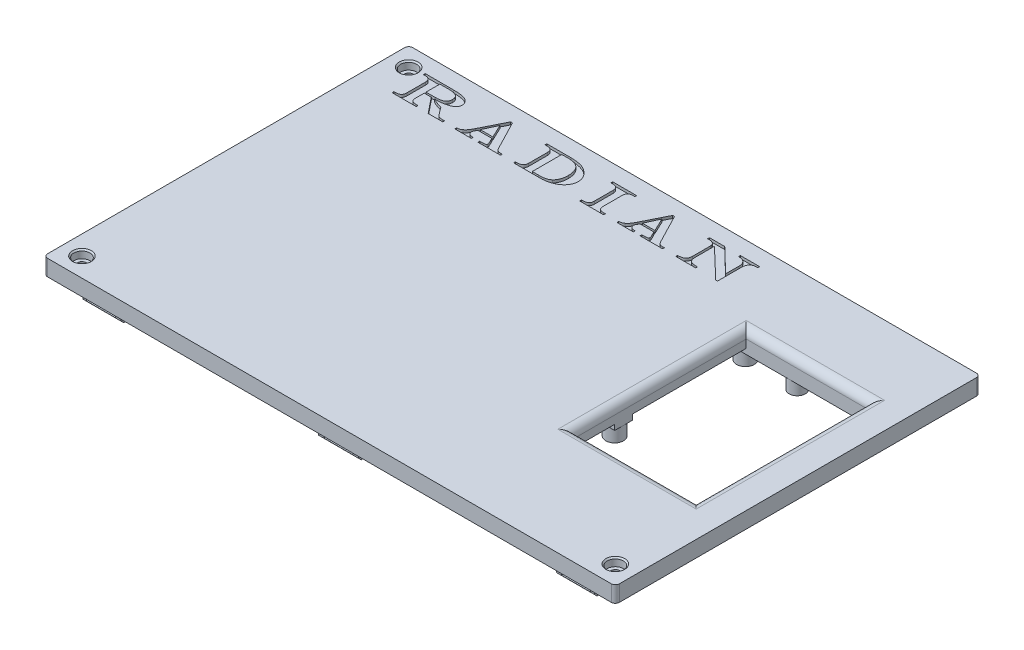
from build123d import *

# Parameters (mm, degrees)
SKETCH2_W                = 213
SKETCH2_H                = 136
BOSS_EXTRUDE1_DEPTH      = 6
SKETCH3_W                = 206.2
SKETCH3_H                = 129.2
SKETCH3_W_2              = 200.2
SKETCH3_H_2              = 123.2
BOSS_EXTRUDE2_DEPTH      = 5
CAVITY2_START            = -5
CAVITY2_DEPTH            = 4.9746
CAVITY2_START_2          = -43.000000397
CAVITY2_2_DEPTH          = 10
CAVITY2_START_3          = 133.999999603
CAVITY2_3_DEPTH          = 10
CAVITY2_START_4          = 45.501885188
CAVITY2_4_DEPTH          = 9.998720912
CAVITY2_START_5          = -52.600000397
CAVITY2_5_DEPTH          = 7.8
CAVITY2_START_6          = 145.799999603
CAVITY2_6_DEPTH          = 7.8
CAVITY2_START_7          = 45.5006061
CAVITY2_7_DEPTH          = 0.001279088
CAVITY2_START_8          = 55.5006061
CAVITY2_8_DEPTH          = 0.001279088
FILLET1_R                = 1.5
CUT_EXTRUDE11_DEPTH      = 10.4
CUT_EXTRUDE11_DEPTH_BACK = 0.4
CUT_EXTRUDE12_DEPTH      = 10.4
CUT_EXTRUDE12_DEPTH_BACK = 0.4
CUT_EXTRUDE13_DEPTH      = 10.4
CUT_EXTRUDE13_DEPTH_BACK = 0.4
CUT_EXTRUDE14_DEPTH      = 10.4
CUT_EXTRUDE14_DEPTH_BACK = 0.4
CUT_EXTRUDE16_DEPTH      = 10.4
CUT_EXTRUDE16_DEPTH_BACK = 0.4
CUT_EXTRUDE17_DEPTH      = 10.4
CUT_EXTRUDE17_DEPTH_BACK = 0.4
SKETCH21_W               = 30.188219543
SKETCH21_H               = 17.978761861
SKETCH21_W_2             = 73.700606497
SKETCH21_H_2             = 37.883194367
SKETCH21_W_3             = 73.699393503
SKETCH21_H_3             = 44.583623302
SKETCH21_W_4             = 30.925056626
SKETCH21_H_4             = 41.233408835
CUT_EXTRUDE18_DEPTH      = 206.591244647
CHAMFER4_SIZE            = 1
SKETCH22_R               = 3.3
SKETCH22_R_2             = 3
BOSS_EXTRUDE4_DEPTH      = 7
SKETCH23_W               = 6
SKETCH23_H               = 123.2
BOSS_EXTRUDE5_DEPTH      = 2
CUT_EXTRUDE19_DEPTH      = 186.002867946
CUT_EXTRUDE19_DEPTH_BACK = 186.002867946
SKETCH24_W               = 45.53325447
SKETCH24_H               = 64.188285164
FILLET6_R                = 3
SKETCH26_R               = 1.65
CUT_EXTRUDE20_DEPTH      = 4
CUT_EXTRUDE21_START      = -1
CUT_EXTRUDE21_DEPTH      = 1
SKETCH29_R               = 1.7
CUT_EXTRUDE22_DEPTH      = 186.326903603
SKETCH30_R               = 3
CUT_EXTRUDE23_DEPTH      = 3
CHAMFER5_SIZE            = 0.5


# Read off the part's stored shape, not the designer's step: Cavity2, Cut-Extrude21
with BuildPart() as part:
    # Sketch2 → Boss-Extrude1 (new body)
    with BuildSketch(Plane(origin=(0, 0, 0), x_dir=(1, 0, 0), z_dir=(0, 1, 0))):
        with Locations((50.499999603, -29.611788596)):
            Rectangle(SKETCH2_W, SKETCH2_H)
    extrude(amount=BOSS_EXTRUDE1_DEPTH)

    # Sketch3 → Boss-Extrude2 (add)
    with BuildSketch(Plane.XZ):
        with Locations((50.499999603, 29.611788596)):
            Rectangle(SKETCH3_W, SKETCH3_H)
        with Locations((50.499999603, 29.611788596)):
            Rectangle(SKETCH3_W_2, SKETCH3_H_2, mode=Mode.SUBTRACT)
    extrude(amount=BOSS_EXTRUDE2_DEPTH)

    # Cavity2 outline → Cavity2 (cut)
    with BuildSketch(Plane(origin=(0, 0, 0), x_dir=(1, 0, 0), z_dir=(0, 1, 0)).offset(CAVITY2_START)):
        with BuildLine():
            Line((-44.800000397, 31.988211404), (-44.800000397, 34.988211404))
            Line((-44.800000397, 34.988211404), (-52.600000397, 34.988211404))
            Line((-52.600000397, 34.988211404), (-52.600000397, 27.188211404))
            Line((-52.600000397, 27.188211404), (-49.600000397, 27.188211404))
            Line((-49.600000397, 27.188211404), (-49.600000397, 29.355181126))
            ThreePointArc((-49.600000397, 29.355181126), (-50.214213959, 32.602424966), (-46.966970119, 31.988211404))
            Line((-46.966970119, 31.988211404), (-44.800000397, 31.988211404))
        make_face()
        with BuildLine():
            Line((153.599999603, -86.411788596), (150.599999603, -86.411788596))
            Line((150.599999603, -86.411788596), (150.599999603, -88.578758318))
            ThreePointArc((150.599999603, -88.578758318), (151.214213165, -91.826002158), (147.966969325, -91.211788596))
            Line((147.966969325, -91.211788596), (145.799999603, -91.211788596))
            Line((145.799999603, -91.211788596), (145.799999603, -94.211788596))
            Line((145.799999603, -94.211788596), (153.599999603, -94.211788596))
            Line((153.599999603, -94.211788596), (153.599999603, -86.411788596))
        make_face()
        with BuildLine():
            Line((-49.600000397, -86.411788596), (-52.600000397, -86.411788596))
            Line((-52.600000397, -86.411788596), (-52.600000397, -94.211788596))
            Line((-52.600000397, -94.211788596), (-44.800000397, -94.211788596))
            Line((-44.800000397, -94.211788596), (-44.800000397, -91.211788596))
            Line((-44.800000397, -91.211788596), (-46.966970119, -91.211788596))
            ThreePointArc((-46.966970119, -91.211788596), (-50.214213959, -91.826002158), (-49.600000397, -88.578758318))
            Line((-49.600000397, -88.578758318), (-49.600000397, -86.411788596))
        make_face()
    extrude(amount=CAVITY2_DEPTH, mode=Mode.SUBTRACT)

    # Cavity2 2 outline → Cavity2 2 (cut)
    with BuildSketch(Plane.YZ.offset(CAVITY2_START_2)):
        with BuildLine():
            ThreePointArc((-2.742557288, -34.671054117), (-3.0254, -34.553896829), (-3.308242712, -34.671054117))
            Line((-3.308242712, -34.671054117), (-3.6254, -34.988211404))
            Line((-3.6254, -34.988211404), (-2.4254, -34.988211404))
            Line((-2.4254, -34.988211404), (-2.742557288, -34.671054117))
        make_face()
        with BuildLine():
            Line((-3.6254, 94.211788596), (-3.308242712, 93.894631308))
            ThreePointArc((-3.308242712, 93.894631308), (-3.0254, 93.777474021), (-2.742557288, 93.894631308))
            Line((-2.742557288, 93.894631308), (-2.4254, 94.211788596))
            Line((-2.4254, 94.211788596), (-3.6254, 94.211788596))
        make_face()
    extrude(amount=CAVITY2_2_DEPTH, mode=Mode.SUBTRACT)

    # Cavity2 3 outline → Cavity2 3 (cut)
    with BuildSketch(Plane.YZ.offset(CAVITY2_START_3)):
        with BuildLine():
            ThreePointArc((-2.742557288, -34.671054117), (-3.0254, -34.553896829), (-3.308242712, -34.671054117))
            Line((-3.308242712, -34.671054117), (-3.6254, -34.988211404))
            Line((-3.6254, -34.988211404), (-2.4254, -34.988211404))
            Line((-2.4254, -34.988211404), (-2.742557288, -34.671054117))
        make_face()
        with BuildLine():
            Line((-3.6254, 94.211788596), (-3.308242712, 93.894631308))
            ThreePointArc((-3.308242712, 93.894631308), (-3.0254, 93.777474021), (-2.742557288, 93.894631308))
            Line((-2.742557288, 93.894631308), (-2.4254, 94.211788596))
            Line((-2.4254, 94.211788596), (-3.6254, 94.211788596))
        make_face()
    extrude(amount=CAVITY2_3_DEPTH, mode=Mode.SUBTRACT)

    # Cavity2 4 outline → Cavity2 4 (cut)
    with BuildSketch(Plane.YZ.offset(CAVITY2_START_4)):
        with BuildLine():
            ThreePointArc((-2.742557288, -34.671054117), (-3.0254, -34.553896829), (-3.308242712, -34.671054117))
            Line((-3.308242712, -34.671054117), (-3.6254, -34.988211404))
            Line((-3.6254, -34.988211404), (-2.4254, -34.988211404))
            Line((-2.4254, -34.988211404), (-2.742557288, -34.671054117))
        make_face()
        with BuildLine():
            Line((-3.6254, 94.211788596), (-3.308242712, 93.894631308))
            ThreePointArc((-3.308242712, 93.894631308), (-3.0254, 93.777474021), (-2.742557288, 93.894631308))
            Line((-2.742557288, 93.894631308), (-2.4254, 94.211788596))
            Line((-2.4254, 94.211788596), (-3.6254, 94.211788596))
        make_face()
    extrude(amount=CAVITY2_4_DEPTH, mode=Mode.SUBTRACT)

    # Cavity2 5 outline → Cavity2 5 (cut)
    with BuildSketch(Plane.YZ.offset(CAVITY2_START_5)):
        with BuildLine():
            ThreePointArc((-2.742557288, -34.671054117), (-3.0254, -34.553896829), (-3.308242712, -34.671054117))
            Line((-3.308242712, -34.671054117), (-3.6254, -34.988211404))
            Line((-3.6254, -34.988211404), (-2.4254, -34.988211404))
            Line((-2.4254, -34.988211404), (-2.742557288, -34.671054117))
        make_face()
        with BuildLine():
            Line((-3.6254, 94.211788596), (-3.308242712, 93.894631308))
            ThreePointArc((-3.308242712, 93.894631308), (-3.0254, 93.777474021), (-2.742557288, 93.894631308))
            Line((-2.742557288, 93.894631308), (-2.4254, 94.211788596))
            Line((-2.4254, 94.211788596), (-3.6254, 94.211788596))
        make_face()
    extrude(amount=CAVITY2_5_DEPTH, mode=Mode.SUBTRACT)

    # Cavity2 6 outline → Cavity2 6 (cut)
    with BuildSketch(Plane.YZ.offset(CAVITY2_START_6)):
        with BuildLine():
            Line((-3.6254, 94.211788596), (-3.308242712, 93.894631308))
            ThreePointArc((-3.308242712, 93.894631308), (-3.0254, 93.777474021), (-2.742557288, 93.894631308))
            Line((-2.742557288, 93.894631308), (-2.4254, 94.211788596))
            Line((-2.4254, 94.211788596), (-3.6254, 94.211788596))
        make_face()
    extrude(amount=CAVITY2_6_DEPTH, mode=Mode.SUBTRACT)

    # Cavity2 7 outline → Cavity2 7 (cut)
    with BuildSketch(Plane.YZ.offset(CAVITY2_START_7)):
        with BuildLine():
            Line((-3.6254, 94.211788596), (-3.308242712, 93.894631308))
            ThreePointArc((-3.308242712, 93.894631308), (-3.0254, 93.777474021), (-2.742557288, 93.894631308))
            Line((-2.742557288, 93.894631308), (-2.4254, 94.211788596))
            Line((-2.4254, 94.211788596), (-3.6254, 94.211788596))
        make_face()
    extrude(amount=CAVITY2_7_DEPTH, mode=Mode.SUBTRACT)

    # Cavity2 8 outline → Cavity2 8 (cut)
    with BuildSketch(Plane.YZ.offset(CAVITY2_START_8)):
        with BuildLine():
            ThreePointArc((-2.742557288, -34.671054117), (-3.0254, -34.553896829), (-3.308242712, -34.671054117))
            Line((-3.308242712, -34.671054117), (-3.6254, -34.988211404))
            Line((-3.6254, -34.988211404), (-2.4254, -34.988211404))
            Line((-2.4254, -34.988211404), (-2.742557288, -34.671054117))
        make_face()
    extrude(amount=CAVITY2_8_DEPTH, mode=Mode.SUBTRACT)

    # Fillet1
    fillet1_edges = [part.edges().sort_by_distance(p)[0] for p in [
        (156.999999603, 3, 97.611788596),
        (-56.000000397, 3, 97.611788596),
        (-56.000000397, 3, -38.388211404),
        (156.999999603, 3, -38.388211404),
    ]]
    fillet(fillet1_edges, radius=FILLET1_R)

    # Sketch14 → Cut-Extrude11 (cut, two sides: drawn at the far end of the back side and taken through both)
    with BuildSketch(Plane(origin=(-43.000000397, 0, 0), x_dir=(0, 0, -1), z_dir=(1, 0, 0)).offset(-CUT_EXTRUDE11_DEPTH_BACK)):
        Polygon((-94.353528476, -1.717974695), (-93.187524527, -2.883978644), (-94.416466858, -4.112920975), align=None)
    extrude(amount=CUT_EXTRUDE11_DEPTH + CUT_EXTRUDE11_DEPTH_BACK, mode=Mode.SUBTRACT)

    # Sketch15 → Cut-Extrude12 (cut, two sides: drawn at the far end of the back side and taken through both)
    with BuildSketch(Plane.ZY.offset(-55.5006061).offset(-CUT_EXTRUDE12_DEPTH_BACK)):
        Polygon((94.853600808, -1.217902363), (93.187524527, -2.883978644), (95.132348202, -4.828802319), align=None)
    extrude(amount=CUT_EXTRUDE12_DEPTH + CUT_EXTRUDE12_DEPTH_BACK, mode=Mode.SUBTRACT)

    # Sketch16 → Cut-Extrude13 (cut, two sides: drawn at the far end of the back side and taken through both)
    with BuildSketch(Plane.ZY.offset(-143.999999603).offset(-CUT_EXTRUDE13_DEPTH_BACK)):
        Polygon((94.69839733, -1.373105841), (93.187524527, -2.883978644), (95.464915153, -5.161369269), align=None)
    extrude(amount=CUT_EXTRUDE13_DEPTH + CUT_EXTRUDE13_DEPTH_BACK, mode=Mode.SUBTRACT)

    # Sketch17 → Cut-Extrude14 (cut, two sides: drawn at the far end of the back side and taken through both)
    with BuildSketch(Plane(origin=(-43.000000397, 0, 0), x_dir=(0, 0, -1), z_dir=(1, 0, 0)).offset(-CUT_EXTRUDE14_DEPTH_BACK)):
        Polygon((35.355341415, -1.492584564), (33.963947335, -2.883978644), (35.071405453, -3.991436761), align=None)
    extrude(amount=CUT_EXTRUDE14_DEPTH + CUT_EXTRUDE14_DEPTH_BACK, mode=Mode.SUBTRACT)

    # Sketch18 → Cut-Extrude16 (cut, two sides: drawn at the far end of the back side and taken through both)
    with BuildSketch(Plane(origin=(45.501885188, 0, 0), x_dir=(0, 0, -1), z_dir=(1, 0, 0)).offset(-CUT_EXTRUDE16_DEPTH_BACK)):
        Polygon((35.566076624, -1.281849355), (33.963947335, -2.883978644), (35.899977656, -4.820008964), align=None)
    extrude(amount=CUT_EXTRUDE16_DEPTH + CUT_EXTRUDE16_DEPTH_BACK, mode=Mode.SUBTRACT)

    # Sketch19 → Cut-Extrude17 (cut, two sides: drawn at the far end of the back side and taken through both)
    with BuildSketch(Plane(origin=(133.999999603, 0, 0), x_dir=(0, 0, -1), z_dir=(1, 0, 0)).offset(-CUT_EXTRUDE17_DEPTH_BACK)):
        Polygon((35.809407674, -1.038518305), (33.963947335, -2.883978644), (35.992757415, -4.912788724), align=None)
    extrude(amount=CUT_EXTRUDE17_DEPTH + CUT_EXTRUDE17_DEPTH_BACK, mode=Mode.SUBTRACT)

    # Sketch21 → Cut-Extrude18 (cut, through all)
    with BuildSketch(Plane.XY.offset(94.211788596)):
        with Locations((-60.494110169, -10.849095506)):
            Rectangle(SKETCH21_W, SKETCH21_H)
        with Locations((6.250302851, -20.801311758)):
            Rectangle(SKETCH21_W_2, SKETCH21_H_2)
        with Locations((94.750302852, -24.151526226)):
            Rectangle(SKETCH21_W_3, SKETCH21_H_3)
        with Locations((161.862527916, -22.476418993)):
            Rectangle(SKETCH21_W_4, SKETCH21_H_4)
    extrude(amount=-CUT_EXTRUDE18_DEPTH, mode=Mode.SUBTRACT)

    # Chamfer4
    chamfer4_edges = [part.edges().sort_by_distance(p)[0] for p in [
        (-37.700000397, -5, -34.988211404),
        (50.5006061, -5, 94.211788596),
        (-37.700000397, -5, 94.211788596),
        (50.5006061, -5, -34.988211404),
        (138.999999603, -5, -34.988211404),
        (138.699999603, -5, 94.211788596),
    ]]
    chamfer(chamfer4_edges, length=CHAMFER4_SIZE)

    # Sketch22 → Boss-Extrude4 (add)
    with BuildSketch(Plane.XZ):
        with Locations(Location((46.940785486, 86.211788596, 0), (0, 0, 270))):
            Circle(SKETCH22_R)
        with Locations(Location((-2.059214514, 86.211788596, 0), (0, 0, 270))):
            Circle(SKETCH22_R)
        with Locations(Location((46.940785486, 28.211788596, 0), (0, 0, 270))):
            Circle(SKETCH22_R)
        with Locations(Location((-2.059214514, 28.211788596, 0), (0, 0, 270))):
            Circle(SKETCH22_R)
        with Locations(Location((64.734891786, -12.788874358, 0), (0, 0, 270))):
            Circle(SKETCH22_R)
        with Locations(Location((64.734891786, 36.211125642, 0), (0, 0, 270))):
            Circle(SKETCH22_R)
        with Locations(Location((86.27684887, -12.788874358, 0), (0, 0, 270))):
            Circle(SKETCH22_R)
        with Locations(Location((86.27684887, 36.114733843, 0), (0, 0, 270))):
            Circle(SKETCH22_R)
        with Locations(Location((95.087234702, -12.788874358, 0), (0, 0, 270))):
            Circle(SKETCH22_R)
        with Locations(Location((95.37114887, 36.211125642, 0), (0, 0, 270))):
            Circle(SKETCH22_R)
        with Locations(Location((114.37114887, -12.788874358, 0), (0, 0, 270))):
            Circle(SKETCH22_R_2)
    extrude(amount=BOSS_EXTRUDE4_DEPTH)

    # Sketch23 → Boss-Extrude5 (add)
    with BuildSketch(Plane.XZ):
        with Locations((-2.059214514, 29.611788596)):
            Rectangle(SKETCH23_W, SKETCH23_H)
        Polygon((43.640785486, 58.265710988), (43.640785486, -33.609956021), (50.240785486, -33.609956021), (50.240785486, -16.088874358), (150.468692023, -16.088874358), (150.468692023, -9.488874358), (50.240785486, -9.488874358), (50.240785486, 32.911125642), (150.599999603, 32.911125642), (150.599999603, 39.511125642), (50.240785486, 39.511125642), (50.240785486, 91.211788596), (43.640785486, 91.211788596), align=None)
    extrude(amount=BOSS_EXTRUDE5_DEPTH)

    # Sketch24 → Cut-Extrude19 (cut, two sides: drawn at the far end of the back side and taken through both)
    with BuildSketch(Plane.XZ.offset(-CUT_EXTRUDE19_DEPTH_BACK)):
        with Locations((121.437776105, 22.605268224)):
            Rectangle(SKETCH24_W, SKETCH24_H)
    extrude(amount=CUT_EXTRUDE19_DEPTH + CUT_EXTRUDE19_DEPTH_BACK, mode=Mode.SUBTRACT)

    # Fillet6
    fillet6_edges = [part.edges().sort_by_distance(p)[0] for p in [
        (121.437776105, 6, -9.488874358),
        (98.67114887, 6, 22.605268224),
        (121.437776105, 6, 54.699410806),
        (144.20440334, 6, 22.605268224),
    ]]
    fillet(fillet6_edges, radius=FILLET6_R)

    # Sketch26 → Cut-Extrude20 (cut)
    with BuildSketch(Plane.XZ.offset(7)):
        with Locations(Location((46.940785486, 28.211788596, 0), (0, 0, 270))):
            Circle(SKETCH26_R)
        with Locations(Location((-2.059214514, 28.211788596, 0), (0, 0, 270))):
            Circle(SKETCH26_R)
        with Locations(Location((-2.059214514, 86.211788596, 0), (0, 0, 270))):
            Circle(SKETCH26_R)
        with Locations(Location((46.940785486, 86.211788596, 0), (0, 0, 270))):
            Circle(SKETCH26_R)
        with Locations(Location((64.734891786, -12.788874358, 0), (0, 0, 270))):
            Circle(SKETCH26_R)
        with Locations(Location((86.27684887, -12.788874358, 0), (0, 0, 270))):
            Circle(SKETCH26_R)
        with Locations(Location((95.087234702, -12.788874358, 0), (0, 0, 270))):
            Circle(SKETCH26_R)
        with Locations(Location((114.37114887, -12.788874358, 0), (0, 0, 270))):
            Circle(SKETCH26_R)
        with Locations(Location((95.37114887, 36.211125642, 0), (0, 0, 270))):
            Circle(SKETCH26_R)
        with Locations(Location((86.27684887, 36.114733843, 0), (0, 0, 270))):
            Circle(SKETCH26_R)
        with Locations(Location((64.734891786, 36.211125642, 0), (0, 0, 270))):
            Circle(SKETCH26_R)
    extrude(amount=-CUT_EXTRUDE20_DEPTH, mode=Mode.SUBTRACT)

    # Cut-Extrude21 outline → Cut-Extrude21 (cut)
    # profile 1 of 6: a face of its own
    with BuildSketch(Plane(origin=(0, 6, 0), x_dir=(1, 0, 0), z_dir=(0, 1, 0)).offset(CUT_EXTRUDE21_START)):
        with BuildLine():
            add(Edge.make_bspline(
                [(76.787164818, 28.69194135), (76.783293868, 28.837057), (76.775745705, 29.120025461), (76.713495937, 29.5302152), (76.606232006, 29.911250759), (76.458186723, 30.261617616), (76.270483801, 30.578256258), (76.046060029, 30.858164756), (75.779632483, 31.093348759), (75.578759636, 31.215418903), (75.477842893, 31.276745864)],
                knots=[0, 0, 0, 0, 0.142880424, 0.278609878, 0.407384071, 0.531829129, 0.65215669, 0.768807633, 0.883850999, 1, 1, 1, 1], degree=3))
            Line((76.787164818, 28.69194135), (76.787164818, 23.683719915))
            Line((76.787164818, 23.683719915), (67.798917096, 32.346589425))
            Line((67.798917096, 32.346589425), (62.126924108, 32.346589425))
            Line((62.126924108, 32.346589425), (62.126924108, 31.680214847))
            Line((62.126924108, 31.680214847), (62.465317448, 31.680214847))
            add(Edge.make_bspline(
                [(64.959016063, 29.873715015), (64.955480626, 29.965059217), (64.948617802, 30.142372264), (64.896640635, 30.39763605), (64.806412327, 30.631366128), (64.680972158, 30.843776286), (64.518783536, 31.033361474), (64.324013141, 31.202430139), (64.091382901, 31.34437765), (63.828148027, 31.467150898), (63.530788088, 31.562911851), (63.202893718, 31.632035397), (62.843847031, 31.674104469), (62.594720795, 31.678125966), (62.465317448, 31.680214847)],
                knots=[0, 0, 0, 0, 0.078830819, 0.15302266, 0.223693261, 0.294224766, 0.364915215, 0.438205283, 0.515942944, 0.599393584, 0.68846488, 0.784995083, 0.888320249, 1, 1, 1, 1], degree=3))
            Line((64.959016063, 29.873715015), (64.959016063, 23.100642159))
            add(Edge.make_bspline(
                [(61.887445744, 20.659004058), (61.984674439, 20.66439797), (62.174151731, 20.674909515), (62.448361193, 20.701408781), (62.70525797, 20.732791056), (62.944332567, 20.768139405), (63.166013417, 20.811901666), (63.369735005, 20.864806799), (63.556109461, 20.920697369), (63.777176666, 21.002759633), (64.022917984, 21.128042425), (64.281946915, 21.310306415), (64.497626207, 21.52761905), (64.668076093, 21.779188068), (64.79997679, 22.063256819), (64.891471547, 22.380192502), (64.950541763, 22.729692205), (64.956116168, 22.973703535), (64.959016063, 23.100642159)],
                knots=[0, 0, 0, 0, 0.065040812, 0.126750204, 0.183974322, 0.237910516, 0.288151362, 0.334821905, 0.378457035, 0.41807323, 0.492206473, 0.562008052, 0.628812, 0.695527891, 0.763980954, 0.837149536, 0.915282565, 1, 1, 1, 1], degree=3))
            Line((61.887445744, 20.659004058), (61.887445744, 20.018659737))
            Line((61.887445744, 20.018659737), (69.329496204, 20.018659737))
            Line((69.329496204, 20.018659737), (69.329496204, 20.656401032))
            add(Edge.make_bspline(
                [(67.910847201, 20.752712983), (67.991479296, 20.742569841), (68.177506882, 20.719168439), (68.494588746, 20.695701028), (68.886731988, 20.671337568), (69.173274345, 20.661671136), (69.329496204, 20.656401032)],
                knots=[0, 0, 0, 0, 0.171371595, 0.395374126, 0.670360155, 1, 1, 1, 1], degree=3))
            add(Edge.make_bspline(
                [(66.775927998, 21.083297246), (66.861950685, 21.041631046), (67.035714821, 20.957466143), (67.313357082, 20.862270686), (67.606089554, 20.790444825), (67.808109494, 20.76543287), (67.910847201, 20.752712983)],
                knots=[0, 0, 0, 0, 0.240979803, 0.48677446, 0.738997967, 1, 1, 1, 1], degree=3))
            add(Edge.make_bspline(
                [(65.791984286, 23.569186784), (65.794321459, 23.405045149), (65.79873603, 23.095006152), (65.848533264, 22.657700265), (65.926280532, 22.275705117), (66.037402069, 21.946453235), (66.18361171, 21.668255551), (66.35286173, 21.431932557), (66.548123614, 21.231992116), (66.700140961, 21.132765756), (66.775927998, 21.083297246)],
                knots=[0, 0, 0, 0, 0.175752568, 0.331970315, 0.470693642, 0.592677048, 0.702846023, 0.806030556, 0.90329808, 1, 1, 1, 1], degree=3))
            Line((65.791984286, 23.569186784), (65.791984286, 30.516662362))
            Line((65.791984286, 30.516662362), (76.935537282, 19.852066093))
            Line((76.935537282, 19.852066093), (77.62013304, 19.852066093))
            Line((77.62013304, 19.852066093), (77.62013304, 28.619056631))
            add(Edge.make_bspline(
                [(80.314264633, 31.680214847), (80.209996422, 31.678885976), (80.006846539, 31.676296883), (79.711290862, 31.636717447), (79.432083736, 31.583090755), (79.173325525, 31.497239173), (78.930673204, 31.394718043), (78.709596071, 31.262519073), (78.503407705, 31.111300599), (78.318455589, 30.933248972), (78.153493063, 30.731282502), (78.008763984, 30.504541217), (77.886344866, 30.252397579), (77.791959382, 29.972524077), (77.712685166, 29.671083044), (77.659824915, 29.342450442), (77.624896606, 28.989448716), (77.621752283, 28.744961194), (77.62013304, 28.619056631)],
                knots=[0, 0, 0, 0, 0.067018953, 0.130575679, 0.191550435, 0.249625434, 0.305621893, 0.36066717, 0.414922848, 0.469798056, 0.52533078, 0.582311765, 0.642476352, 0.705144474, 0.772023814, 0.842774252, 0.919032927, 1, 1, 1, 1], degree=3))
            Line((80.314264633, 31.680214847), (80.785412284, 31.680214847))
            Line((80.785412284, 31.680214847), (80.785412284, 32.346589425))
            Line((80.785412284, 32.346589425), (73.621885574, 32.346589425))
            Line((73.621885574, 32.346589425), (73.621885574, 31.69062695))
            add(Edge.make_bspline(
                [(75.477842893, 31.276745864), (75.363150069, 31.335883325), (75.139260979, 31.451324133), (74.8302572, 31.54612584), (74.554648068, 31.596281262), (74.293145834, 31.631813007), (73.976380716, 31.665678946), (73.746032452, 31.68188997), (73.621885574, 31.69062695)],
                knots=[0, 0, 0, 0, 0.20138717, 0.393123027, 0.502173024, 0.639110626, 0.805497606, 1, 1, 1, 1], degree=3))
        make_face()
    # profile 2 of 6: a face of its own
    with BuildSketch(Plane(origin=(0, 6, 0), x_dir=(1, 0, 0), z_dir=(0, 1, 0)).offset(CUT_EXTRUDE21_START)):
        with BuildLine():
            add(Edge.make_bspline(
                [(54.288693138, 22.030798599), (54.333486908, 21.945953833), (54.419089865, 21.783811579), (54.560179589, 21.562628356), (54.700851241, 21.370349039), (54.843791708, 21.207276624), (54.992410867, 21.072508696), (55.14374284, 20.959278797), (55.300350469, 20.868323465), (55.461950548, 20.795020193), (55.636925409, 20.746349334), (55.825762331, 20.709942954), (56.033162738, 20.689808869), (56.176714546, 20.686667902), (56.251374511, 20.685034315)],
                knots=[0, 0, 0, 0, 0.113190473, 0.216312206, 0.309295546, 0.394166009, 0.471728587, 0.5456642, 0.616795127, 0.685105998, 0.754452864, 0.830568863, 0.911880435, 1, 1, 1, 1], degree=3))
            Line((54.288693138, 22.030798599), (48.759866564, 32.679776713))
            Line((48.759866564, 32.679776713), (48.064858703, 32.679776713))
            Line((48.064858703, 32.679776713), (43.68396646, 23.931007355))
            add(Edge.make_bspline(
                [(41.747315344, 21.28633325), (41.830135417, 21.34903099), (42.002571083, 21.479570921), (42.246941197, 21.714722215), (42.490151356, 21.988019714), (42.733471881, 22.300268621), (42.973821903, 22.651314158), (43.214056277, 23.041538698), (43.45308364, 23.470933282), (43.605288707, 23.774228283), (43.68396646, 23.931007355)],
                knots=[0, 0, 0, 0, 0.094113707, 0.195949595, 0.306816844, 0.425630226, 0.554594339, 0.692354677, 0.840972162, 1, 1, 1, 1], degree=3))
            add(Edge.make_bspline(
                [(39.95383064, 20.666813135), (40.065826697, 20.680110501), (40.272870805, 20.704692986), (40.559252014, 20.747136232), (40.795740334, 20.79844014), (40.995494614, 20.856587921), (41.173805694, 20.936450059), (41.356405261, 21.029466179), (41.549585994, 21.148160273), (41.679251842, 21.238770576), (41.747315344, 21.28633325)],
                knots=[0, 0, 0, 0, 0.175528749, 0.324495293, 0.450309109, 0.551971045, 0.647540469, 0.753832122, 0.870782879, 1, 1, 1, 1], degree=3))
            Line((39.95383064, 20.666813135), (39.95383064, 20.018659737))
            Line((39.95383064, 20.018659737), (46.063131944, 20.018659737))
            Line((46.063131944, 20.018659737), (46.063131944, 20.666813135))
            add(Edge.make_bspline(
                [(44.803267508, 20.921909653), (44.848075794, 20.898683539), (44.931543496, 20.85541854), (45.052737877, 20.804641486), (45.155565562, 20.761016797), (45.257325975, 20.730452256), (45.383248368, 20.712282743), (45.556379435, 20.699622391), (45.78954584, 20.679179343), (45.965034845, 20.671247165), (46.063131944, 20.666813135)],
                knots=[0, 0, 0, 0, 0.116255279, 0.216557292, 0.302704918, 0.373572751, 0.460689656, 0.595202459, 0.773721067, 1, 1, 1, 1], degree=3))
            add(Edge.make_bspline(
                [(43.975505338, 22.166155935), (43.978170015, 22.100706889), (43.983506187, 21.969641372), (44.038007234, 21.777543516), (44.114118008, 21.587995511), (44.22744883, 21.411707469), (44.356660418, 21.25185502), (44.496060598, 21.113174297), (44.644346018, 21.002431557), (44.751245271, 20.948268137), (44.803267508, 20.921909653)],
                knots=[0, 0, 0, 0, 0.124733996, 0.249787076, 0.379097299, 0.5138815, 0.648257263, 0.771349951, 0.888728061, 1, 1, 1, 1], degree=3))
            add(Edge.make_bspline(
                [(44.326913806, 23.087627031), (44.27320188, 23.012775413), (44.170056363, 22.869034363), (44.060474863, 22.6355686), (43.986707318, 22.402318772), (43.979193094, 22.243902088), (43.975505338, 22.166155935)],
                knots=[0, 0, 0, 0, 0.274807347, 0.527725353, 0.76822178, 1, 1, 1, 1], degree=3))
            Line((44.326913806, 23.087627031), (44.683528327, 23.850313559))
            Line((44.683528327, 23.850313559), (49.899991818, 23.850313559))
            Line((49.899991818, 23.850313559), (50.074394539, 23.491096013))
            add(Edge.make_bspline(
                [(50.280033569, 23.079817953), (50.267715454, 23.103160634), (50.237461892, 23.160490771), (50.19175292, 23.259530499), (50.138142607, 23.374615678), (50.095645257, 23.452266746), (50.074394539, 23.491096013)],
                knots=[0, 0, 0, 0, 0.172133662, 0.422764058, 0.711354282, 1, 1, 1, 1], degree=3))
            add(Edge.make_bspline(
                [(50.998468661, 21.288936276), (50.996633298, 21.326318745), (50.992634755, 21.407760672), (50.96875166, 21.53639668), (50.924307717, 21.678974025), (50.877625299, 21.808714096), (50.828957694, 21.928632415), (50.783845074, 22.040016766), (50.720957221, 22.167162621), (50.655953488, 22.31543607), (50.575506382, 22.480061799), (50.489394858, 22.664738297), (50.385103898, 22.864678651), (50.316135504, 23.005896561), (50.280033569, 23.079817953)],
                knots=[0, 0, 0, 0, 0.057797256, 0.125917842, 0.201435925, 0.288385481, 0.338930854, 0.401435778, 0.474015981, 0.5580208, 0.651583825, 0.757137928, 0.872872338, 1, 1, 1, 1], degree=3))
            add(Edge.make_bspline(
                [(49.733398173, 20.685034315), (49.84193856, 20.686873359), (50.042104927, 20.690264859), (50.315694078, 20.717767898), (50.538216189, 20.761010971), (50.711418878, 20.828072137), (50.840402279, 20.917150538), (50.933494921, 21.023612306), (50.988124126, 21.151546774), (50.9949685, 21.242449375), (50.998468661, 21.288936276)],
                knots=[0, 0, 0, 0, 0.208408828, 0.384340234, 0.527497051, 0.642612622, 0.738312014, 0.825794972, 0.910912871, 1, 1, 1, 1], degree=3))
            Line((49.733398173, 20.685034315), (48.567242662, 20.685034315))
            Line((48.567242662, 20.685034315), (48.567242662, 20.018659737))
            Line((48.567242662, 20.018659737), (56.94117632, 20.018659737))
            Line((56.94117632, 20.018659737), (56.94117632, 20.685034315))
            Line((56.94117632, 20.685034315), (56.251374511, 20.685034315))
        make_face()
        Polygon((47.24490561, 29.514497469), (49.62667412, 24.516688137), (44.930815767, 24.516688137), align=None, mode=Mode.SUBTRACT)
    # profile 3 of 6: a face of its own
    with BuildSketch(Plane(origin=(0, 6, 0), x_dir=(1, 0, 0), z_dir=(0, 1, 0)).offset(CUT_EXTRUDE21_START)):
        with BuildLine():
            add(Edge.make_bspline(
                [(26.60239125, 20.685034315), (26.697033689, 20.686347755), (26.880551046, 20.688894594), (27.145479219, 20.713670811), (27.392372097, 20.747699252), (27.617415632, 20.803080691), (27.824907742, 20.870153329), (28.010989968, 20.956263316), (28.180005068, 21.054600907), (28.327392542, 21.170823834), (28.457162858, 21.302740801), (28.56844189, 21.452372881), (28.667063633, 21.616716161), (28.74115652, 21.801945597), (28.800681206, 22.00246289), (28.844987859, 22.219215586), (28.871329004, 22.452699978), (28.873637891, 22.613805272), (28.874832681, 22.697173176)],
                knots=[0, 0, 0, 0, 0.081133488, 0.157322692, 0.228036004, 0.294628529, 0.355804738, 0.414736152, 0.470117574, 0.523108175, 0.57519784, 0.628324087, 0.682686472, 0.739063606, 0.798857693, 0.86189693, 0.928535163, 1, 1, 1, 1], degree=3))
            Line((26.60239125, 20.685034315), (26.060961905, 20.685034315))
            Line((26.060961905, 20.685034315), (26.060961905, 20.018659737))
            Line((26.060961905, 20.018659737), (35.007561216, 20.018659737))
            Line((35.007561216, 20.018659737), (35.007561216, 20.685034315))
            Line((35.007561216, 20.685034315), (34.302141253, 20.685034315))
            add(Edge.make_bspline(
                [(32.206705569, 22.697173176), (32.208158837, 22.609493963), (32.210955921, 22.440739014), (32.233457224, 22.19763853), (32.275488071, 21.974821675), (32.332372478, 21.770767234), (32.404338025, 21.585089731), (32.494011885, 21.41937782), (32.59745479, 21.271053114), (32.722857527, 21.14565601), (32.861963535, 21.034490392), (33.019217166, 20.941177987), (33.192599027, 20.863372841), (33.381618321, 20.798080177), (33.587841071, 20.74588), (33.811727177, 20.710302773), (34.051869296, 20.68988053), (34.217069046, 20.686681636), (34.302141253, 20.685034315)],
                knots=[0, 0, 0, 0, 0.078253205, 0.150612843, 0.217596537, 0.280359846, 0.339466616, 0.394908273, 0.448204334, 0.500230512, 0.552601392, 0.606790246, 0.662936003, 0.72196154, 0.785072677, 0.852551479, 0.924069067, 1, 1, 1, 1], degree=3))
            Line((32.206705569, 22.697173176), (32.206705569, 29.668075985))
            add(Edge.make_bspline(
                [(34.302141253, 31.680214847), (34.216208404, 31.678532432), (34.049289812, 31.675264457), (33.807317253, 31.655376545), (33.583024547, 31.618576833), (33.375398021, 31.569832796), (33.184907828, 31.505375941), (33.012298433, 31.424480704), (32.857379365, 31.329657578), (32.71672701, 31.223332289), (32.59515932, 31.095643308), (32.491102885, 30.948701917), (32.402687261, 30.783245039), (32.327953772, 30.598780205), (32.276599569, 30.392440155), (32.233345905, 30.168537201), (32.211009379, 29.924488734), (32.208177115, 29.755747877), (32.206705569, 29.668075985)],
                knots=[0, 0, 0, 0, 0.076603746, 0.148797457, 0.216187169, 0.279029642, 0.33870842, 0.395104489, 0.448560079, 0.500385003, 0.55180436, 0.605030057, 0.660398516, 0.718708449, 0.781930523, 0.849586004, 0.921850109, 1, 1, 1, 1], degree=3))
            Line((34.302141253, 31.680214847), (35.007561216, 31.680214847))
            Line((35.007561216, 31.680214847), (35.007561216, 32.346589425))
            Line((35.007561216, 32.346589425), (26.060961905, 32.346589425))
            Line((26.060961905, 32.346589425), (26.060961905, 31.680214847))
            Line((26.060961905, 31.680214847), (26.60239125, 31.680214847))
            add(Edge.make_bspline(
                [(28.226679283, 31.258524684), (28.179669624, 31.292595786), (28.083889775, 31.362013967), (27.922733282, 31.447827547), (27.745409937, 31.519821225), (27.550818516, 31.581397801), (27.337393316, 31.622402194), (27.107570349, 31.658381292), (26.860307811, 31.674434042), (26.690036639, 31.67825041), (26.60239125, 31.680214847)],
                knots=[0, 0, 0, 0, 0.101869634, 0.207554331, 0.319616212, 0.437701577, 0.565313568, 0.700866886, 0.846024211, 1, 1, 1, 1], degree=3))
            add(Edge.make_bspline(
                [(28.874832681, 29.910157375), (28.861888126, 29.995354804), (28.837334827, 30.156957733), (28.788262872, 30.383098228), (28.732145315, 30.580498927), (28.664009607, 30.751170095), (28.581115575, 30.900137987), (28.484410801, 31.036577278), (28.363623502, 31.15539485), (28.272596749, 31.223945198), (28.226679283, 31.258524684)],
                knots=[0, 0, 0, 0, 0.167202259, 0.317150121, 0.448760078, 0.565079946, 0.67285957, 0.778955552, 0.888496504, 1, 1, 1, 1], degree=3))
            Line((28.874832681, 29.910157375), (28.874832681, 22.697173176))
        make_face()
    # profile 4 of 6: a face of its own
    with BuildSketch(Plane(origin=(0, 6, 0), x_dir=(1, 0, 0), z_dir=(0, 1, 0)).offset(CUT_EXTRUDE21_START)):
        with BuildLine():
            add(Edge.make_bspline(
                [(10.598468677, 32.346589425), (10.783301042, 32.345034869), (11.147911093, 32.341968269), (11.686307339, 32.319353426), (12.207738674, 32.275843664), (12.712615465, 32.223626242), (13.199529995, 32.149807919), (13.66935276, 32.061610396), (14.122581533, 31.957237031), (14.560216184, 31.839022899), (14.980978443, 31.699264476), (15.387900267, 31.545886496), (15.776196312, 31.363284041), (16.15080527, 31.167103482), (16.510401014, 30.949695805), (16.852268841, 30.710614576), (17.180518399, 30.452102957), (17.385675842, 30.26459876), (17.488677689, 30.170459944)],
                knots=[0, 0, 0, 0, 0.074850486, 0.147654008, 0.218153706, 0.286718837, 0.353158618, 0.417524695, 0.480258822, 0.541462812, 0.601020765, 0.659749961, 0.717446266, 0.774659065, 0.830942857, 0.887478352, 0.943507106, 1, 1, 1, 1], degree=3))
            Line((10.598468677, 32.346589425), (1.493084799, 32.346589425))
            Line((1.493084799, 32.346589425), (1.493084799, 31.680214847))
            Line((1.493084799, 31.680214847), (2.149047274, 31.680214847))
            add(Edge.make_bspline(
                [(4.418885679, 29.668075985), (4.417730038, 29.751453965), (4.415484849, 29.913441457), (4.388408858, 30.147472251), (4.347841818, 30.365592897), (4.288521292, 30.566633148), (4.210168682, 30.749827489), (4.115381197, 30.915416504), (4.00643812, 31.065808529), (3.876558914, 31.196962294), (3.729248738, 31.31318274), (3.561415209, 31.411378361), (3.374813159, 31.495615945), (3.167422281, 31.561762827), (2.9416468, 31.617611308), (2.694733722, 31.651560152), (2.428946864, 31.676440481), (2.244558889, 31.6789269), (2.149047274, 31.680214847)],
                knots=[0, 0, 0, 0, 0.071426949, 0.138768923, 0.201629741, 0.261392128, 0.318028172, 0.371988937, 0.4246425, 0.47670455, 0.529667058, 0.585019119, 0.642934553, 0.704784282, 0.771341502, 0.842017325, 0.918166137, 1, 1, 1, 1], degree=3))
            Line((4.418885679, 29.668075985), (4.418885679, 22.697173176))
            add(Edge.make_bspline(
                [(2.149047274, 20.685034315), (2.243689709, 20.686347757), (2.427207059, 20.6888946), (2.692135285, 20.713670789), (2.93902798, 20.747699327), (3.164072132, 20.803080438), (3.37156217, 20.870154177), (3.557651578, 20.956260349), (3.726641964, 21.054611068), (3.874116187, 21.170787912), (4.003568807, 21.302873646), (4.115799035, 21.451512507), (4.209736587, 21.61822473), (4.289517045, 21.800671866), (4.343546254, 22.003112874), (4.389399205, 22.219096428), (4.415282586, 22.452733037), (4.417656987, 22.613816545), (4.418885679, 22.697173176)],
                knots=[0, 0, 0, 0, 0.081157245, 0.157368759, 0.228102778, 0.294714802, 0.355908925, 0.414857596, 0.470255234, 0.523261351, 0.57536627, 0.628508073, 0.682513271, 0.739195949, 0.798798794, 0.86185649, 0.928514237, 1, 1, 1, 1], degree=3))
            Line((2.149047274, 20.685034315), (1.493084799, 20.685034315))
            Line((1.493084799, 20.685034315), (1.493084799, 20.018659737))
            Line((1.493084799, 20.018659737), (11.233606946, 20.018659737))
            add(Edge.make_bspline(
                [(19.578907322, 25.997809757), (19.57632959, 25.893667388), (19.571188022, 25.685944031), (19.547633712, 25.3766446), (19.494505497, 25.073327606), (19.432672621, 24.77401088), (19.343773013, 24.482323924), (19.244081679, 24.192888721), (19.117701712, 23.911864875), (18.930151027, 23.54039438), (18.647155795, 23.097285509), (18.245036344, 22.596816646), (17.774160561, 22.13463379), (17.2417407, 21.706894775), (16.650005902, 21.322566967), (16.004550743, 20.984404394), (15.30795942, 20.69182101), (14.563337973, 20.449486037), (13.777605222, 20.257264389), (12.957183053, 20.12027788), (12.10568492, 20.035117576), (11.527081488, 20.024198183), (11.233606946, 20.018659737)],
                knots=[0, 0, 0, 0, 0.027391847, 0.054636039, 0.081452769, 0.108301504, 0.134939077, 0.161564924, 0.188736423, 0.215876299, 0.270940963, 0.326594179, 0.384347072, 0.44406191, 0.505884126, 0.569562616, 0.635407409, 0.70430567, 0.775241762, 0.847890592, 0.922848299, 1, 1, 1, 1], degree=3))
            add(Edge.make_bspline(
                [(17.488677689, 30.170459944), (17.647001727, 30.032181177), (17.960001514, 29.758810026), (18.374563928, 29.295541932), (18.731261682, 28.794159157), (19.033134664, 28.261125551), (19.274019509, 27.707880511), (19.451080945, 27.1438987), (19.559749502, 26.572941283), (19.572533487, 26.189156879), (19.578907322, 25.997809757)],
                knots=[0, 0, 0, 0, 0.130821354, 0.258628168, 0.386083796, 0.513365189, 0.639452615, 0.761143125, 0.880910805, 1, 1, 1, 1], degree=3))
        make_face()
        with BuildLine():
            add(Edge.make_bspline(
                [(14.076111004, 30.579134978), (13.998089598, 30.643671435), (13.843085578, 30.771885098), (13.593248109, 30.943433114), (13.327468646, 31.089417779), (13.048640326, 31.22269333), (12.748713398, 31.334513), (12.425832687, 31.429818618), (12.077631399, 31.511820807), (11.7015071, 31.571676981), (11.294490272, 31.622733201), (10.851367977, 31.65442152), (10.369611302, 31.675694361), (10.035373751, 31.678669783), (9.861812406, 31.680214847)],
                knots=[0, 0, 0, 0, 0.068165016, 0.13542247, 0.203695083, 0.272174905, 0.343365493, 0.418974765, 0.49876907, 0.584068197, 0.675311871, 0.774932098, 0.883127771, 1, 1, 1, 1], degree=3))
            add(Edge.make_bspline(
                [(15.7472535, 26.117548939), (15.744653918, 26.275540591), (15.73951923, 26.587605219), (15.701665185, 27.049813348), (15.643223928, 27.500284127), (15.557384467, 27.93662989), (15.448389973, 28.352613311), (15.322792935, 28.745353045), (15.170644909, 29.108595951), (14.998257202, 29.446168394), (14.804574988, 29.762312275), (14.584977748, 30.055026781), (14.346105456, 30.33248299), (14.16635613, 30.496692026), (14.076111004, 30.579134978)],
                knots=[0, 0, 0, 0, 0.096475212, 0.190557544, 0.283034008, 0.373755599, 0.461921935, 0.545537844, 0.625346486, 0.702128438, 0.776832638, 0.851440934, 0.925414287, 1, 1, 1, 1], degree=3))
            add(Edge.make_bspline(
                [(14.190644135, 21.780908132), (14.315474254, 21.902795128), (14.566354057, 22.147759932), (14.884323184, 22.574338324), (15.151188938, 23.049615304), (15.372641776, 23.570369925), (15.540580313, 24.141199698), (15.661845194, 24.757111972), (15.735540611, 25.421619111), (15.743263459, 25.880477729), (15.7472535, 26.117548939)],
                knots=[0, 0, 0, 0, 0.110127371, 0.221330666, 0.334777149, 0.453938341, 0.578151268, 0.710100507, 0.850222224, 1, 1, 1, 1], degree=3))
            add(Edge.make_bspline(
                [(10.036215127, 20.685034315), (10.214109141, 20.686593209), (10.554408246, 20.689575269), (11.043184356, 20.710335814), (11.487695542, 20.743742054), (11.893080117, 20.78834728), (12.262573582, 20.855670557), (12.605870161, 20.931842886), (12.922539701, 21.027700119), (13.215800939, 21.14080859), (13.487509977, 21.271178086), (13.741662392, 21.419753465), (13.977200554, 21.588795153), (14.119741659, 21.717091334), (14.190644135, 21.780908132)],
                knots=[0, 0, 0, 0, 0.121196562, 0.23184075, 0.333217287, 0.424872501, 0.509523174, 0.588967125, 0.66432987, 0.734697815, 0.802912336, 0.869420121, 0.93504725, 1, 1, 1, 1], degree=3))
            Line((10.036215127, 20.685034315), (7.750758568, 20.685034315))
            Line((7.750758568, 20.685034315), (7.750758568, 31.680214847))
            Line((7.750758568, 31.680214847), (9.861812406, 31.680214847))
        make_face(mode=Mode.SUBTRACT)
    # profile 5 of 6: a face of its own
    with BuildSketch(Plane(origin=(0, 6, 0), x_dir=(1, 0, 0), z_dir=(0, 1, 0)).offset(CUT_EXTRUDE21_START)):
        with BuildLine():
            add(Edge.make_bspline(
                [(-6.084843602, 22.030798599), (-6.040049832, 21.945953833), (-5.954446875, 21.783811579), (-5.813357151, 21.562628356), (-5.672685499, 21.370349039), (-5.529745032, 21.207276624), (-5.381125873, 21.072508696), (-5.2297939, 20.959278797), (-5.073186271, 20.868323465), (-4.911586192, 20.795020193), (-4.736611331, 20.746349334), (-4.547774409, 20.709942954), (-4.340374002, 20.689808869), (-4.196822194, 20.686667902), (-4.122162229, 20.685034315)],
                knots=[0, 0, 0, 0, 0.113190473, 0.216312206, 0.309295546, 0.394166009, 0.471728587, 0.5456642, 0.616795127, 0.685105998, 0.754452864, 0.830568863, 0.911880435, 1, 1, 1, 1], degree=3))
            Line((-6.084843602, 22.030798599), (-11.613670176, 32.679776713))
            Line((-11.613670176, 32.679776713), (-12.308678037, 32.679776713))
            Line((-12.308678037, 32.679776713), (-16.68957028, 23.931007355))
            add(Edge.make_bspline(
                [(-18.626221396, 21.28633325), (-18.543401323, 21.34903099), (-18.370965657, 21.479570921), (-18.126595543, 21.714722215), (-17.883385384, 21.988019714), (-17.640064858, 22.300268621), (-17.399714837, 22.651314158), (-17.159480463, 23.041538698), (-16.9204531, 23.470933282), (-16.768248033, 23.774228283), (-16.68957028, 23.931007355)],
                knots=[0, 0, 0, 0, 0.094113707, 0.195949595, 0.306816844, 0.425630226, 0.554594339, 0.692354677, 0.840972162, 1, 1, 1, 1], degree=3))
            add(Edge.make_bspline(
                [(-20.4197061, 20.666813135), (-20.307710043, 20.680110501), (-20.100665935, 20.704692986), (-19.814284726, 20.747136232), (-19.577796406, 20.79844014), (-19.378042126, 20.856587921), (-19.199731046, 20.936450059), (-19.017131479, 21.029466179), (-18.823950746, 21.148160273), (-18.694284897, 21.238770576), (-18.626221396, 21.28633325)],
                knots=[0, 0, 0, 0, 0.175528749, 0.324495293, 0.450309109, 0.551971045, 0.647540469, 0.753832122, 0.870782879, 1, 1, 1, 1], degree=3))
            Line((-20.4197061, 20.666813135), (-20.4197061, 20.018659737))
            Line((-20.4197061, 20.018659737), (-14.310404795, 20.018659737))
            Line((-14.310404795, 20.018659737), (-14.310404795, 20.666813135))
            add(Edge.make_bspline(
                [(-15.570269231, 20.921909653), (-15.525460946, 20.898683539), (-15.441993244, 20.85541854), (-15.320798863, 20.804641486), (-15.217971178, 20.761016797), (-15.116210764, 20.730452256), (-14.990288372, 20.712282743), (-14.817157304, 20.699622391), (-14.5839909, 20.679179343), (-14.408501895, 20.671247165), (-14.310404795, 20.666813135)],
                knots=[0, 0, 0, 0, 0.116255279, 0.216557292, 0.302704918, 0.373572751, 0.460689656, 0.595202459, 0.773721067, 1, 1, 1, 1], degree=3))
            add(Edge.make_bspline(
                [(-16.398031402, 22.166155935), (-16.395366725, 22.100706889), (-16.390030553, 21.969641372), (-16.335529506, 21.777543516), (-16.259418732, 21.587995511), (-16.14608791, 21.411707469), (-16.016876322, 21.25185502), (-15.877476142, 21.113174297), (-15.729190721, 21.002431557), (-15.622291469, 20.948268137), (-15.570269231, 20.921909653)],
                knots=[0, 0, 0, 0, 0.124733996, 0.249787076, 0.379097299, 0.5138815, 0.648257263, 0.771349951, 0.888728061, 1, 1, 1, 1], degree=3))
            add(Edge.make_bspline(
                [(-16.046622933, 23.087627031), (-16.10033486, 23.012775413), (-16.203480377, 22.869034363), (-16.313061877, 22.6355686), (-16.386829421, 22.402318772), (-16.394343646, 22.243902088), (-16.398031402, 22.166155935)],
                knots=[0, 0, 0, 0, 0.274807347, 0.527725353, 0.76822178, 1, 1, 1, 1], degree=3))
            Line((-16.046622933, 23.087627031), (-15.690008413, 23.850313559))
            Line((-15.690008413, 23.850313559), (-10.473544922, 23.850313559))
            Line((-10.473544922, 23.850313559), (-10.299142201, 23.491096013))
            add(Edge.make_bspline(
                [(-10.093503171, 23.079817953), (-10.105821286, 23.103160634), (-10.136074848, 23.160490771), (-10.18178382, 23.259530499), (-10.235394133, 23.374615678), (-10.277891483, 23.452266746), (-10.299142201, 23.491096013)],
                knots=[0, 0, 0, 0, 0.172133662, 0.422764058, 0.711354282, 1, 1, 1, 1], degree=3))
            add(Edge.make_bspline(
                [(-9.375068079, 21.288936276), (-9.376903441, 21.326318745), (-9.380901985, 21.407760672), (-9.40478508, 21.53639668), (-9.449229023, 21.678974025), (-9.495911441, 21.808714096), (-9.544579046, 21.928632415), (-9.589691666, 22.040016766), (-9.652579519, 22.167162621), (-9.717583252, 22.31543607), (-9.798030358, 22.480061799), (-9.884141882, 22.664738297), (-9.988432842, 22.864678651), (-10.057401236, 23.005896561), (-10.093503171, 23.079817953)],
                knots=[0, 0, 0, 0, 0.057797256, 0.125917842, 0.201435925, 0.288385481, 0.338930854, 0.401435778, 0.474015981, 0.5580208, 0.651583825, 0.757137928, 0.872872338, 1, 1, 1, 1], degree=3))
            add(Edge.make_bspline(
                [(-10.640138567, 20.685034315), (-10.531598179, 20.686873359), (-10.331431813, 20.690264859), (-10.057842661, 20.717767898), (-9.835320551, 20.761010971), (-9.662117862, 20.828072137), (-9.53313446, 20.917150538), (-9.440041818, 21.023612306), (-9.385412614, 21.151546774), (-9.37856824, 21.242449375), (-9.375068079, 21.288936276)],
                knots=[0, 0, 0, 0, 0.208408828, 0.384340234, 0.527497051, 0.642612622, 0.738312014, 0.825794972, 0.910912871, 1, 1, 1, 1], degree=3))
            Line((-10.640138567, 20.685034315), (-11.806294078, 20.685034315))
            Line((-11.806294078, 20.685034315), (-11.806294078, 20.018659737))
            Line((-11.806294078, 20.018659737), (-3.43236042, 20.018659737))
            Line((-3.43236042, 20.018659737), (-3.43236042, 20.685034315))
            Line((-3.43236042, 20.685034315), (-4.122162229, 20.685034315))
        make_face()
        Polygon((-10.74686262, 24.516688137), (-15.442720972, 24.516688137), (-13.12863113, 29.514497469), align=None, mode=Mode.SUBTRACT)
    # profile 6 of 6: a face of its own
    with BuildSketch(Plane(origin=(0, 6, 0), x_dir=(1, 0, 0), z_dir=(0, 1, 0)).offset(CUT_EXTRUDE21_START)):
        with BuildLine():
            add(Edge.make_bspline(
                [(-37.662668903, 22.684158048), (-37.661518557, 22.598180674), (-37.659293399, 22.431871406), (-37.632490875, 22.192592775), (-37.59152341, 21.972155162), (-37.534282345, 21.77076708), (-37.462283443, 21.586372738), (-37.370020605, 21.421889888), (-37.264056896, 21.273491897), (-37.135988393, 21.148255022), (-36.994396003, 21.036848121), (-36.833786057, 20.944425582), (-36.658570796, 20.862028677), (-36.465618696, 20.799326549), (-36.257380699, 20.745324414), (-36.031565923, 20.71043833), (-35.788878392, 20.68984882), (-35.62193997, 20.686670549), (-35.535996911, 20.685034315)],
                knots=[0, 0, 0, 0, 0.076476937, 0.147932214, 0.213958075, 0.275791969, 0.334005376, 0.389653042, 0.443243109, 0.495657702, 0.548480196, 0.603171469, 0.660174012, 0.720485007, 0.783408485, 0.851448862, 0.923523063, 1, 1, 1, 1], degree=3))
            Line((-37.662668903, 22.684158048), (-37.662668903, 25.849437292))
            Line((-37.662668903, 25.849437292), (-35.038819003, 25.849437292))
            Line((-35.038819003, 25.849437292), (-30.366387882, 20.018659737))
            Line((-30.366387882, 20.018659737), (-24.93907931, 20.018659737))
            Line((-24.93907931, 20.018659737), (-24.93907931, 20.685034315))
            Line((-24.93907931, 20.685034315), (-25.647102299, 20.685034315))
            add(Edge.make_bspline(
                [(-27.234947972, 21.010412527), (-27.134023871, 20.958999878), (-26.919690115, 20.849814204), (-26.545355787, 20.755073014), (-26.115915484, 20.69551722), (-25.809615003, 20.688668183), (-25.647102299, 20.685034315)],
                knots=[0, 0, 0, 0, 0.206891628, 0.439378299, 0.702553035, 1, 1, 1, 1], degree=3))
            add(Edge.make_bspline(
                [(-28.976372161, 22.983506003), (-28.884072033, 22.859884025), (-28.705263681, 22.620397446), (-28.438364518, 22.281402367), (-28.184600152, 21.972010388), (-27.947070122, 21.696598202), (-27.726738719, 21.462753016), (-27.538346903, 21.268286587), (-27.378016516, 21.121635059), (-27.277859238, 21.043772058), (-27.234947972, 21.010412527)],
                knots=[0, 0, 0, 0, 0.175413928, 0.339820494, 0.490521624, 0.630386169, 0.753237851, 0.855789726, 0.938214721, 1, 1, 1, 1], degree=3))
            add(Edge.make_bspline(
                [(-29.798928281, 24.068967717), (-29.749668988, 24.00460778), (-29.65832006, 23.885255451), (-29.527939655, 23.720824826), (-29.423541949, 23.57849233), (-29.304231987, 23.419383002), (-29.15492038, 23.226170296), (-29.038493468, 23.067934864), (-28.976372161, 22.983506003)],
                knots=[0, 0, 0, 0, 0.178523091, 0.331062267, 0.462172817, 0.567290158, 0.769121246, 1, 1, 1, 1], degree=3))
            Line((-29.798928281, 24.068967717), (-30.13211557, 24.519291162))
            add(Edge.make_bspline(
                [(-33.84738292, 25.850094513), (-33.743396257, 25.793630787), (-33.438726475, 25.630235556), (-32.931782979, 25.377481753), (-32.316530032, 25.117045735), (-31.791566466, 24.932363406), (-31.346939224, 24.799915667), (-30.974676226, 24.70557964), (-30.566350031, 24.608176079), (-30.28067099, 24.549699472), (-30.13211557, 24.519291162)],
                knots=[0.084753023, 0.084753023, 0.084753023, 0.084753023, 0.166698726, 0.324176061, 0.476852289, 0.629078507, 0.709311144, 0.798069085, 0.894994285, 1, 1, 1, 1], degree=3))
            add(Edge.make_bspline(
                [(-32.149460483, 25.904100832), (-32.284791167, 25.895778456), (-32.577862092, 25.877755592), (-33.049979177, 25.860378032), (-33.480692047, 25.852149943), (-33.753421697, 25.850455716), (-33.84738292, 25.850094513)],
                knots=[0, 0, 0, 0, 0.201252403, 0.435830413, 0.701195632, 0.840668179, 0.840668179, 0.840668179, 0.840668179], degree=3))
            add(Edge.make_bspline(
                [(-28.416721637, 26.739672079), (-28.521924016, 26.692060964), (-28.748694578, 26.589432114), (-29.12776453, 26.460893544), (-29.564069055, 26.332047653), (-30.224255209, 26.176789654), (-31.090383042, 26.011404806), (-31.797351426, 25.939775939), (-32.149460483, 25.904100832)],
                knots=[0, 0, 0, 0, 0.090128073, 0.194276916, 0.312202757, 0.445320555, 0.723739193, 1, 1, 1, 1], degree=3))
            add(Edge.make_bspline(
                [(-26.667488371, 29.077189153), (-26.67185849, 28.961220486), (-26.680519896, 28.7313751), (-26.769533255, 28.397043442), (-26.90485169, 28.076632931), (-27.102212139, 27.776148899), (-27.350554418, 27.488938902), (-27.654458935, 27.219714113), (-28.012609762, 26.964637954), (-28.27802614, 26.816882762), (-28.416721637, 26.739672079)],
                knots=[0, 0, 0, 0, 0.112799935, 0.223565082, 0.334948422, 0.450603711, 0.572333401, 0.704094093, 0.84537195, 1, 1, 1, 1], degree=3))
            add(Edge.make_bspline(
                [(-27.674859314, 31.084121963), (-27.595301882, 31.008310915), (-27.439932512, 30.860257938), (-27.235248551, 30.617733872), (-27.059925563, 30.366770074), (-26.920332093, 30.104958), (-26.80824638, 29.843776531), (-26.726050288, 29.585227135), (-26.67690819, 29.329825489), (-26.670601676, 29.16068694), (-26.667488371, 29.077189153)],
                knots=[0, 0, 0, 0, 0.142685673, 0.278653829, 0.411549769, 0.53966465, 0.663410055, 0.780355161, 0.891569023, 1, 1, 1, 1], degree=3))
            add(Edge.make_bspline(
                [(-33.206288914, 32.346589425), (-33.030146946, 32.345362888), (-32.686491894, 32.342969901), (-32.183929643, 32.330971805), (-31.707600852, 32.306270055), (-31.257600957, 32.278020864), (-30.835426404, 32.230911712), (-30.439128243, 32.183775633), (-30.069988879, 32.1242291), (-29.726114709, 32.053634059), (-29.404839518, 31.972629066), (-29.101820138, 31.882611503), (-28.818127177, 31.777818572), (-28.55246588, 31.664355375), (-28.305519661, 31.538210248), (-28.076395158, 31.401689132), (-27.86680499, 31.249454053), (-27.738343015, 31.138803544), (-27.674859314, 31.084121963)],
                knots=[0, 0, 0, 0, 0.091231366, 0.177993467, 0.260331925, 0.338263856, 0.4114654, 0.480304842, 0.544950415, 0.605058408, 0.662062376, 0.716513253, 0.768691335, 0.818612492, 0.866044298, 0.91220953, 0.956615458, 1, 1, 1, 1], degree=3))
            Line((-33.206288914, 32.346589425), (-43.798000464, 32.346589425))
            Line((-43.798000464, 32.346589425), (-43.798000464, 31.680214847))
            Line((-43.798000464, 31.680214847), (-43.266983222, 31.680214847))
            add(Edge.make_bspline(
                [(-40.994541791, 29.668075985), (-40.995815117, 29.751427961), (-40.998288945, 29.913364933), (-41.023779205, 30.147918716), (-41.06989836, 30.364737604), (-41.123906113, 30.567180882), (-41.203692184, 30.749626841), (-41.2976273, 30.916341517), (-41.409861878, 31.064971943), (-41.539299692, 31.197088535), (-41.686830404, 31.313147013), (-41.854601357, 31.411388591), (-42.041221418, 31.495612947), (-42.248606999, 31.56176372), (-42.474384054, 31.617611045), (-42.721296668, 31.65156023), (-42.987083662, 31.676440459), (-43.171471618, 31.678926893), (-43.266983222, 31.680214847)],
                knots=[0, 0, 0, 0, 0.07139975, 0.138716081, 0.201697905, 0.261229035, 0.317843512, 0.37178373, 0.424861592, 0.476903817, 0.529846157, 0.58517714, 0.64307052, 0.704896698, 0.771428573, 0.842077484, 0.918197299, 1, 1, 1, 1], degree=3))
            Line((-40.994541791, 29.668075985), (-40.994541791, 22.697173176))
            add(Edge.make_bspline(
                [(-43.266983222, 20.685034315), (-43.172340783, 20.686347755), (-42.988823426, 20.688894594), (-42.723895253, 20.713670811), (-42.477002375, 20.747699252), (-42.25195884, 20.803080691), (-42.04446673, 20.870153329), (-41.858384504, 20.956263316), (-41.689369404, 21.054600907), (-41.541981931, 21.170823834), (-41.412211614, 21.302740801), (-41.300932582, 21.452372881), (-41.202310839, 21.616716161), (-41.128217952, 21.801945597), (-41.068693266, 22.00246289), (-41.024386613, 22.219215586), (-40.998045468, 22.452699978), (-40.995736581, 22.613805272), (-40.994541791, 22.697173176)],
                knots=[0, 0, 0, 0, 0.081133488, 0.157322692, 0.228036004, 0.294628529, 0.355804738, 0.414736152, 0.470117574, 0.523108175, 0.57519784, 0.628324087, 0.682686472, 0.739063606, 0.798857693, 0.86189693, 0.928535163, 1, 1, 1, 1], degree=3))
            Line((-43.266983222, 20.685034315), (-43.798000464, 20.685034315))
            Line((-43.798000464, 20.685034315), (-43.798000464, 20.018659737))
            Line((-43.798000464, 20.018659737), (-34.807149716, 20.018659737))
            Line((-34.807149716, 20.018659737), (-34.807149716, 20.685034315))
            Line((-34.807149716, 20.685034315), (-35.535996911, 20.685034315))
        make_face()
        with BuildLine():
            add(Edge.make_bspline(
                [(-30.332548548, 29.111028487), (-30.335503119, 29.215318903), (-30.341219085, 29.41708101), (-30.386577307, 29.709546656), (-30.459459834, 29.981990715), (-30.559459425, 30.236366956), (-30.695211336, 30.467922356), (-30.857923477, 30.680250383), (-31.04814234, 30.874287375), (-31.271014705, 31.044490539), (-31.52149996, 31.195583496), (-31.803138842, 31.325295781), (-32.111911955, 31.437280547), (-32.451403105, 31.524576341), (-32.818411791, 31.593882387), (-33.214507338, 31.646779219), (-33.640613508, 31.673789133), (-33.934235697, 31.67802424), (-34.086111599, 31.680214847)],
                knots=[0, 0, 0, 0, 0.060557614, 0.117155845, 0.171440153, 0.224133453, 0.275397225, 0.326809445, 0.379200568, 0.432733264, 0.489264129, 0.548791521, 0.612565128, 0.679803736, 0.752161362, 0.829432304, 0.911773961, 1, 1, 1, 1], degree=3))
            add(Edge.make_bspline(
                [(-34.143378164, 26.51581187), (-33.930691222, 26.519219583), (-33.525446538, 26.525712495), (-32.948383229, 26.576450438), (-32.434321876, 26.663079932), (-31.980622384, 26.783978571), (-31.585140227, 26.942214301), (-31.245369891, 27.138087243), (-30.95788112, 27.368695759), (-30.72688056, 27.64040426), (-30.546979631, 27.949484277), (-30.422268711, 28.300681793), (-30.346364945, 28.692162781), (-30.337282963, 28.967497288), (-30.332548548, 29.111028487)],
                knots=[0, 0, 0, 0, 0.121179146, 0.230889607, 0.329727737, 0.417883431, 0.49794226, 0.571716665, 0.640593789, 0.706875681, 0.773781572, 0.843224199, 0.918273162, 1, 1, 1, 1], degree=3))
            Line((-34.143378164, 26.51581187), (-37.662668903, 26.51581187))
            Line((-37.662668903, 26.51581187), (-37.662668903, 31.680214847))
            Line((-37.662668903, 31.680214847), (-34.086111599, 31.680214847))
        make_face(mode=Mode.SUBTRACT)
    extrude(amount=CUT_EXTRUDE21_DEPTH, mode=Mode.SUBTRACT)

    # Sketch29 → Cut-Extrude22 (cut, through all)
    with BuildSketch(Plane(origin=(0, 6, 0), x_dir=(1, 0, 0), z_dir=(0, 1, 0))):
        with Locations(Location((-48.860000397, -90.471788596, 0), (0, 0, 270))):
            Circle(SKETCH29_R)
        with Locations(Location((-48.860000397, 31.248211404, 0), (0, 0, 270))):
            Circle(SKETCH29_R)
        with Locations(Location((149.859999603, -90.471788596, 0), (0, 0, 270))):
            Circle(SKETCH29_R)
    extrude(amount=-CUT_EXTRUDE22_DEPTH, mode=Mode.SUBTRACT)

    # Sketch30 → Cut-Extrude23 (cut)
    with BuildSketch(Plane(origin=(0, 6, 0), x_dir=(1, 0, 0), z_dir=(0, 1, 0))):
        with Locations(Location((-48.860000397, -90.471788596, 0), (0, 0, 270))):
            Circle(SKETCH30_R)
        with Locations(Location((-48.860000397, 31.248211404, 0), (0, 0, 270))):
            Circle(SKETCH30_R)
        with Locations(Location((149.859999603, -90.471788596, 0), (0, 0, 270))):
            Circle(SKETCH30_R)
    extrude(amount=-CUT_EXTRUDE23_DEPTH, mode=Mode.SUBTRACT)

    # Chamfer5
    chamfer5_edges = [part.edges().sort_by_distance(p)[0] for p in [
        (149.859999603, 6, 87.471788596),
        (-48.860000397, 6, -34.248211404),
        (-48.860000397, 6, 87.471788596),
    ]]
    chamfer(chamfer5_edges, length=CHAMFER5_SIZE)


solid = part.part
